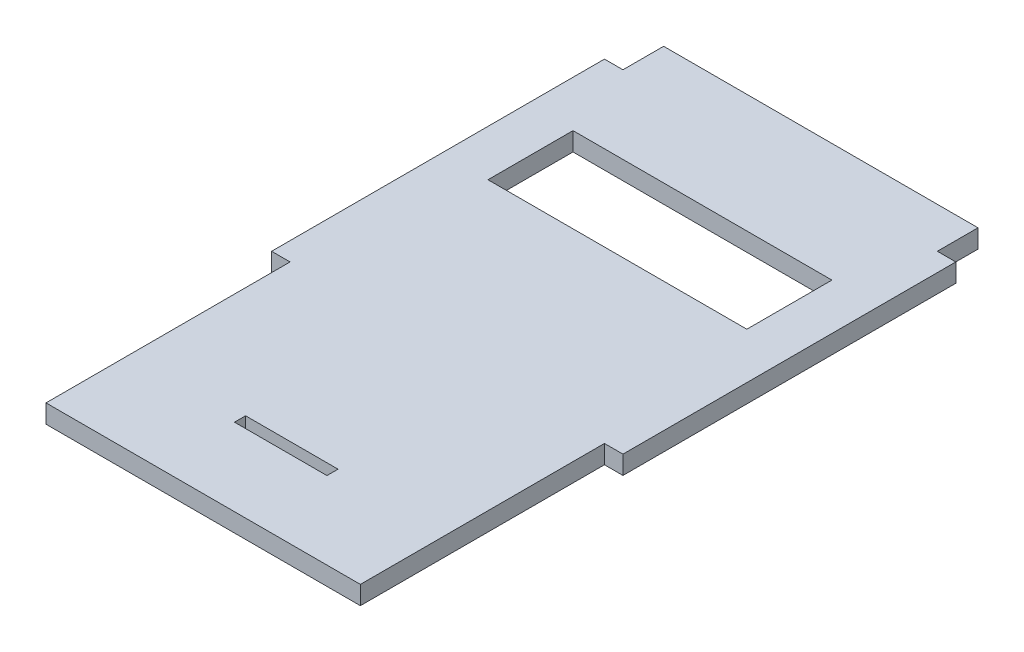
from build123d import *

# Parameters (mm, degrees)
CROQUIS1_W              = 25
CROQUIS1_H              = 3
CROQUIS1_W_2            = 70
CROQUIS1_H_2            = 23
SALIENTE_EXTRUIR1_DEPTH = 5


with BuildPart() as part:
    # Croquis1 → Saliente-Extruir1 (new body)
    with BuildSketch(Plane(origin=(0, 0, 0), x_dir=(1, 0, 0), z_dir=(0, 1, 0))):
        Polygon((-42.5, -83.5), (42.5, -83.5), (42.5, -17.5), (47.5, -17.5), (47.5, 72.5), (42.5, 72.5), (42.5, 83.5), (-42.5, 83.5), (-42.5, 72.5), (-47.5, 72.5), (-47.5, -17.5), (-42.5, -17.5), align=None)
        with Locations((0, -61.039633263)):
            Rectangle(CROQUIS1_W, CROQUIS1_H, mode=Mode.SUBTRACT)
        with Locations((0, 40)):
            Rectangle(CROQUIS1_W_2, CROQUIS1_H_2, mode=Mode.SUBTRACT)
    extrude(amount=SALIENTE_EXTRUIR1_DEPTH)


solid = part.part
